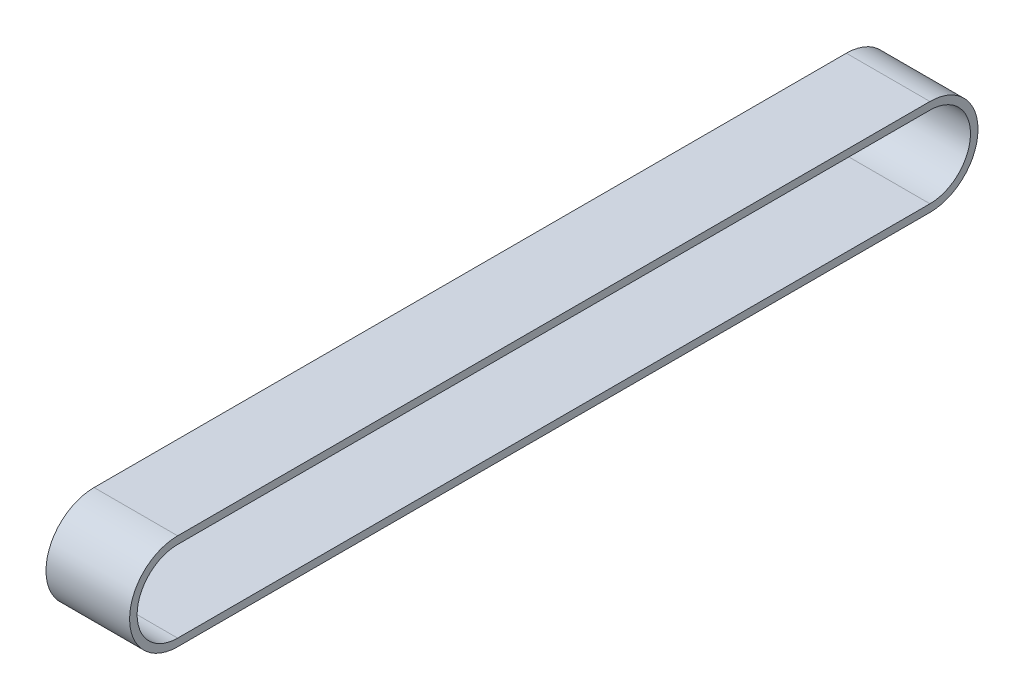
from build123d import *

# Parameters (mm, degrees)
BOSS_EXTRUDE1_DEPTH = 12.7


with BuildPart() as part:
    # Sketch1 → Boss-Extrude1 (new, symmetric)
    with BuildSketch(Plane(origin=(0, 0, 0), x_dir=(0, 0, -1), z_dir=(1, 0, 0))):
        with BuildLine():
            Line((-114.3, 14.605), (114.3, 14.605))
            ThreePointArc((114.3, 14.605), (128.905, 0), (114.3, -14.605))
            Line((114.3, -14.605), (-114.3, -14.605))
            ThreePointArc((-114.3, -14.605), (-128.905, 0), (-114.3, 14.605))
        make_face()
        with BuildLine():
            Line((-114.3, 12.319), (114.3, 12.319))
            ThreePointArc((114.3, 12.319), (126.619, 0), (114.3, -12.319))
            Line((114.3, -12.319), (-114.3, -12.319))
            ThreePointArc((-114.3, -12.319), (-126.619, 0), (-114.3, 12.319))
        make_face(mode=Mode.SUBTRACT)
    extrude(amount=BOSS_EXTRUDE1_DEPTH, both=True)


solid = part.part
